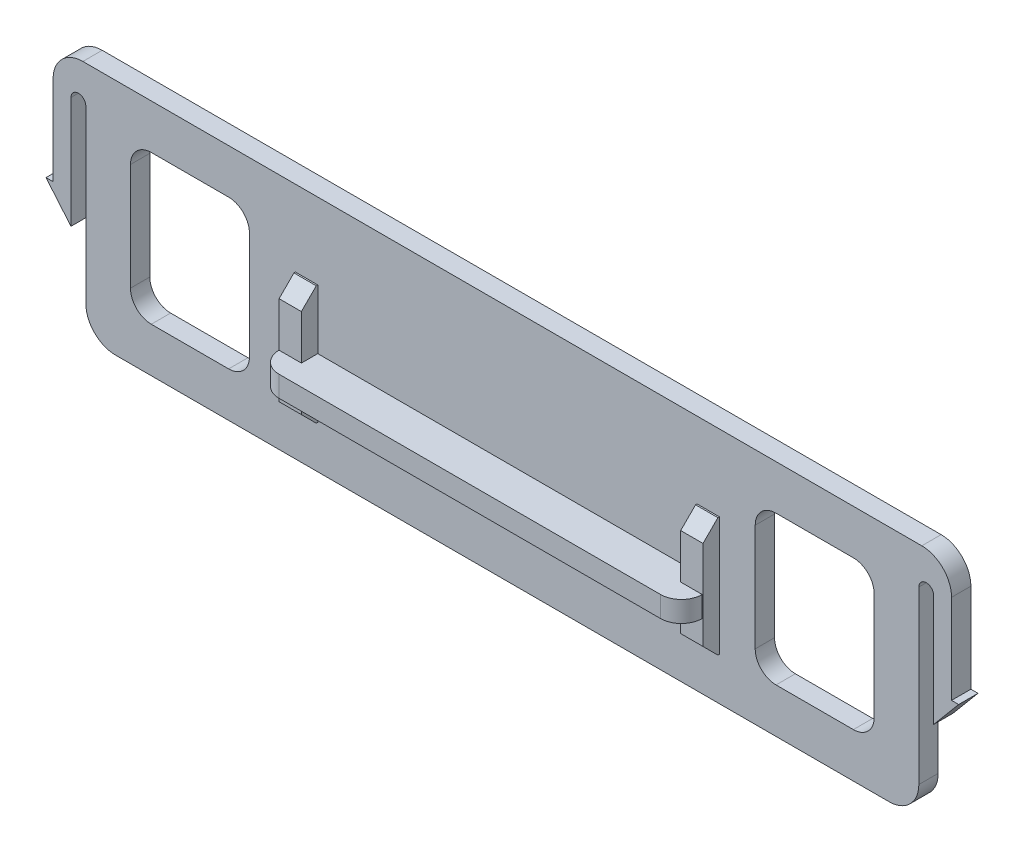
from build123d import *

# Parameters (mm, degrees)
SKETCH_1_W          = 56
SKETCH_1_H          = 16
EXTRUDE_1_DEPTH     = 1.3
EXTRUDE_2_DEPTH     = 1.3
FILLET_1_R          = 2
FILLET_2_R          = 0.5
CHAMFER_1_SIZE      = 2
CHAMFER_1_SIZE_2    = 2.383507185
CHAMFER_2_SIZE      = 2.383507185
CHAMFER_2_SIZE_2    = 2
SKETCH_3_W          = 1.5
SKETCH_3_H          = 8
EXTRUDE_3_DEPTH     = 1.1
CHAMFER_3_SIZE      = 1
SKETCH_4_W          = 28.445563285
SKETCH_4_H          = 1.4
EXTRUDE_4_DEPTH     = 2.5
FILLET_3_R          = 1.4
CUT_EXTRUDE_1_REACH = 33.803
SKETCH_6_W          = 8
SKETCH_6_H          = 10
FILLET_4_R          = 1.4


# Some blends are built 0.0001 mm under size
with BuildPart() as part:
    # 草图1 → 凸台-拉伸1 (new body)
    with BuildSketch(Plane.XY):
        Rectangle(SKETCH_1_W, SKETCH_1_H)
    extrude(amount=EXTRUDE_1_DEPTH)

    # 草图2 → 凸台-拉伸2 (add)
    with BuildSketch(Plane.XY.offset(1.3)):
        Polygon((28, 8), (30.2, 8), (30.2, 0), (31, 0), (31, -2), (29, -2), (29, 6), (28, 6), align=None)
        Polygon((-28, 8), (-30.2, 8), (-30.2, 0), (-31, 0), (-31, -2), (-29, -2), (-29, 6), (-28, 6), align=None)
    extrude(amount=-EXTRUDE_2_DEPTH)

    # 圆角1
    fillet_1_edges = [part.edges().sort_by_distance(p)[0] for p in [
        (-30.2, 8, 0.65),
        (30.2, 8, 0.65),
        (28, -8, 0.65),
        (-28, -8, 0.65),
    ]]
    fillet(fillet_1_edges, radius=FILLET_1_R)

    # 圆角2
    fillet_2_edges = [part.edges().sort_by_distance(p)[0] for p in [
        (28, 6, 0.65),
        (29, 6, 0.65),
        (-28, 6, 0.65),
        (-29, 6, 0.65),
    ]]
    fillet(fillet_2_edges, radius=FILLET_2_R - 0.0001)  # a hair under: the kernel refuses the full size

    # 倒角1
    # the kernel refuses this chamfer: 2.383507185, 2 mm, written as the material it takes off along each edge
    with BuildSketch(Plane(origin=(31, -2, 7.443265966), x_dir=(-0.9993728857116145, -0.03540953691366299, 0), z_dir=(0, 0, -1))) as chamfer_1_piece_1:
        Polygon((CHAMFER_1_SIZE * 0.999372885712, CHAMFER_1_SIZE * 0.0354095369137), (-CHAMFER_1_SIZE_2 * 0.0354095369165, CHAMFER_1_SIZE_2 * 0.999372885791), (0, 0), align=None)
    extrude(amount=13.586531933, mode=Mode.SUBTRACT)

    # 倒角2
    # the kernel refuses this chamfer: 2.383507185, 2 mm, written as the material it takes off along each edge
    with BuildSketch(Plane(origin=(-31, -2, 7.443265966), x_dir=(-0.024939322090233737, 0.9996889667359941, 0), z_dir=(0, 0, -1))) as chamfer_2_piece_1:
        Polygon((CHAMFER_2_SIZE * 0.999688966815, CHAMFER_2_SIZE * 0.0249393220922), (-CHAMFER_2_SIZE_2 * 0.0249393220902, CHAMFER_2_SIZE_2 * 0.999688966736), (0, 0), align=None)
    extrude(amount=13.586531933, mode=Mode.SUBTRACT)

    # 草图3 → 凸台-拉伸3 (add)
    with BuildSketch(Plane.XY.offset(1.3)):
        with Locations((-13.15891381, -1.11681071)):
            Rectangle(SKETCH_3_W, SKETCH_3_H)
        with Locations((13.84108619, -1.11681071)):
            Rectangle(SKETCH_3_W, SKETCH_3_H)
    extrude(amount=EXTRUDE_3_DEPTH)

    # 倒角3
    chamfer_3_edges = [part.edges().sort_by_distance(p)[0] for p in [
        (-13.15891381, -5.11681071, 2.4),
        (-13.15891381, 2.88318929, 2.4),
        (13.84108619, -5.11681071, 2.4),
        (13.84108619, 2.88318929, 2.4),
    ]]
    chamfer(chamfer_3_edges, length=CHAMFER_3_SIZE)

    # 草图4 → 凸台-拉伸4 (add)
    with BuildSketch(Plane.XY.offset(1.3)):
        with Locations((0.313867832, -1.81681071)):
            Rectangle(SKETCH_4_W, SKETCH_4_H)
    extrude(amount=EXTRUDE_4_DEPTH)

    # 圆角3
    fillet_3_edges = [part.edges().sort_by_distance(p)[0] for p in [
        (14.536649475, -1.81681071, 3.8),
        (-13.90891381, -1.81681071, 3.8),
    ]]
    fillet(fillet_3_edges, radius=FILLET_3_R - 0.0001)  # a hair under: the kernel refuses the full size

    # 草图6 → 切除-拉伸1 (cut, up to next)
    with BuildSketch(Plane.XY.offset(1.3), mode=Mode.PRIVATE) as cut_extrude_1_sk1:
        with Locations((-21, 0)):
            Rectangle(SKETCH_6_W, SKETCH_6_H)
    cut_extrude_1_tool1 = extrude(cut_extrude_1_sk1.sketch, amount=-CUT_EXTRUDE_1_REACH, mode=Mode.PRIVATE) & part.part
    # 草图6 → 切除-拉伸1 (cut, up to next)
    with BuildSketch(Plane.XY.offset(1.3), mode=Mode.PRIVATE) as cut_extrude_1_sk2:
        with Locations((21, 0)):
            Rectangle(SKETCH_6_W, SKETCH_6_H)
    cut_extrude_1_tool2 = extrude(cut_extrude_1_sk2.sketch, amount=-CUT_EXTRUDE_1_REACH, mode=Mode.PRIVATE) & part.part
    add(cut_extrude_1_tool1.solids().sort_by_distance((-21, 0, 1.3))[0], mode=Mode.SUBTRACT)
    add(cut_extrude_1_tool2.solids().sort_by_distance((21, 0, 1.3))[0], mode=Mode.SUBTRACT)

    # 圆角4
    fillet_4_edges = [part.edges().sort_by_distance(p)[0] for p in [
        (-17, 5, 0.65),
        (-17, -5, 0.65),
        (-25, -5, 0.65),
        (-25, 5, 0.65),
        (25, 5, 0.65),
        (25, -5, 0.65),
        (17, -5, 0.65),
        (17, 5, 0.65),
    ]]
    fillet(fillet_4_edges, radius=FILLET_4_R)


solid = part.part
